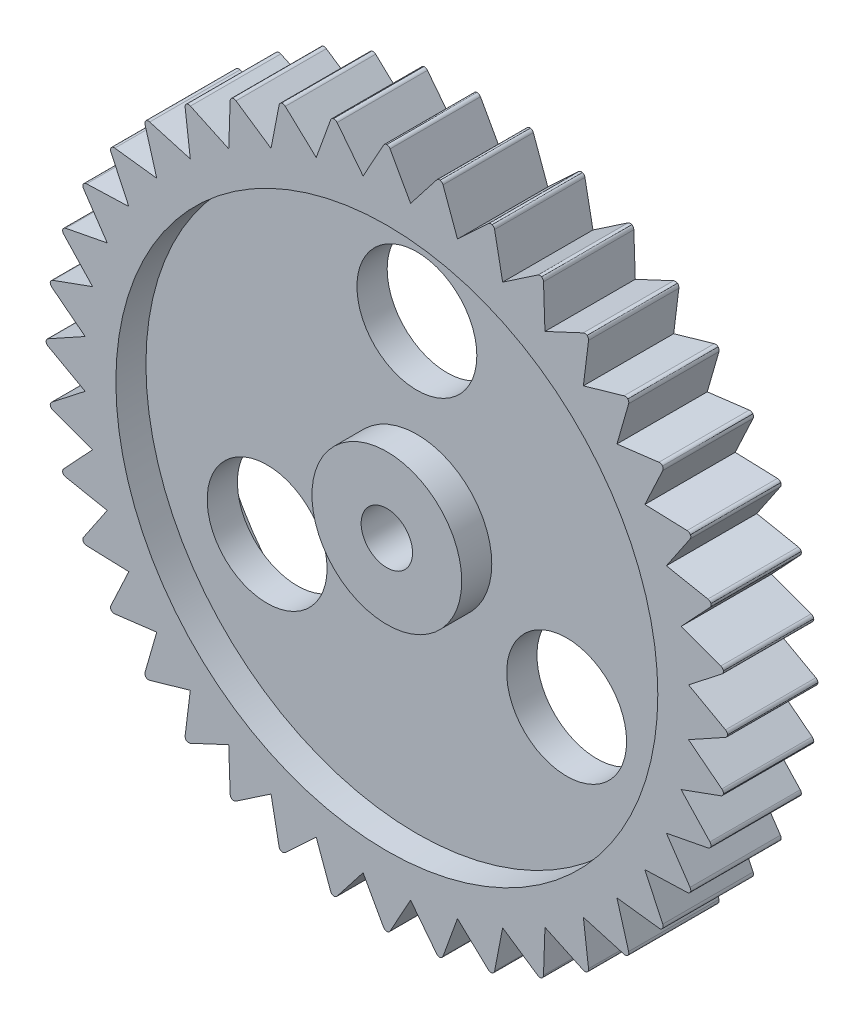
from build123d import *

# Parameters (mm, degrees)
SKETCH1_R         = 20.75
EXTRUDE1_DEPTH    = 2.75
SKETCH3_R         = 16.5
SKETCH3_R_2       = 4.56
EXTRUDE4_DEPTH    = 1.83
EXTRUDE5_REACH    = 31.856
SKETCH4_R         = 1.565
EXTRUDE6_REACH    = 31.574
SKETCH5_R         = 3.65
CIRPATTERN1_COUNT = 3
EXTRUDE17_REACH   = 31.856
CIRPATTERN2_COUNT = 40
FILLET2_R         = 0.25
CIRPATTERN3_START = -2.75
CIRPATTERN3_DEPTH = 5.5


# Read off the part's stored shape, not the designer's step: CirPattern3
with BuildPart() as part:
    # Sketch1 → Extrude1 (new, symmetric)
    with BuildSketch(Plane.XY):
        Circle(SKETCH1_R)
    extrude(amount=EXTRUDE1_DEPTH, both=True)

    # Sketch3 → Extrude4 (cut)
    with BuildSketch(Plane.XY.offset(2.75)):
        Circle(SKETCH3_R)
        Circle(SKETCH3_R_2, mode=Mode.SUBTRACT)
    extrude4 = extrude(amount=-EXTRUDE4_DEPTH, mode=Mode.SUBTRACT)

    # Mirror2: Extrude4 across plane
    add(extrude4.mirror(Plane.XY), mode=Mode.SUBTRACT)

    # Sketch4 → Extrude5 (cut, up to next)
    with BuildSketch(Plane.XY.offset(2.75), mode=Mode.PRIVATE) as extrude5_sk1:
        Circle(SKETCH4_R)
    extrude5_tool1 = extrude(extrude5_sk1.sketch, amount=-EXTRUDE5_REACH, mode=Mode.PRIVATE) & part.part
    add(extrude5_tool1.solids().sort_by_distance((0, 0, 2.75))[0], mode=Mode.SUBTRACT)

    # Sketch5 → Extrude6 (cut, up to next)
    with BuildSketch(Plane.XY.offset(0.92), mode=Mode.PRIVATE) as extrude6_sk1:
        with Locations((0, 10.53)):
            Circle(SKETCH5_R)
    extrude6_tool1 = extrude(extrude6_sk1.sketch, amount=-EXTRUDE6_REACH, mode=Mode.PRIVATE) & part.part
    extrude6 = extrude6_tool1.solids().sort_by_distance((0, 10.53, 0.92))[0]
    add(extrude6, mode=Mode.SUBTRACT)

    # CirPattern1: Extrude6 ×3 about axis
    cirpattern1_axis = Axis((0, 0, 0), (0, 0, 1))
    for i in range(1, CIRPATTERN1_COUNT):
        add(extrude6.rotate(cirpattern1_axis, i * 360 / CIRPATTERN1_COUNT), mode=Mode.SUBTRACT)

    # Sketch14 → Extrude17 (cut, up to next)
    with BuildSketch(Plane.XY.offset(2.75), mode=Mode.PRIVATE) as extrude17_sk1:
        with BuildLine():
            Line((-0.128390857, 20.749602786), (-1.445608839, 18.368201874))
            Line((-1.445608839, 18.368201874), (-3.119142859, 20.514225499))
            add(Edge.make_bspline(
                [(-3.119142859, 20.514225499), (-1.188149235, 20.932935947), (-0.128390857, 20.749602786)],
                knots=[0, 0, 0, 1, 1, 1], degree=2))
        make_face()
    extrude17_tool1 = extrude(extrude17_sk1.sketch, amount=-EXTRUDE17_REACH, mode=Mode.PRIVATE) & part.part
    extrude17 = extrude17_tool1.solids().sort_by_distance((-1.562372, 19.936347, 2.75))[0]
    add(extrude17, mode=Mode.SUBTRACT)

    # CirPattern2: Extrude17 ×40 about axis
    cirpattern2_axis = Axis((0, 0, 0), (0, 0, 1))
    for i in range(1, CIRPATTERN2_COUNT):
        add(extrude17.rotate(cirpattern2_axis, i * 360 / CIRPATTERN2_COUNT), mode=Mode.SUBTRACT)

    # Fillet2
    # the kernel refuses this fillet: 0.25 mm, written as the material it takes off along each edge
    with BuildSketch(Plane(origin=(-6.289872926, 19.773719897, 3.1196585), x_dir=(-0.9518642763784473, -0.3065198188609262, 0), z_dir=(0, 0, -1))) as fillet2_piece_1:
        with BuildLine():
            CenterArc((0.146972657, -0.249998413), FILLET2_R, 89.795856224, 61.105585606)
            Line((-0.071473459, -0.128420065), (0, 0))
            ThreePointArc((0, 0), (0.0739317, 0.000131709), (0.1478634, 0))
        make_face()
    extrude(amount=6.239317001, mode=Mode.SUBTRACT)
    with BuildSketch(Plane(origin=(-6.534086849, 19.694369984, 3.1196585), x_dir=(-0.18992112884271475, -0.9817993505900832, 0), z_dir=(0, 0, -1))) as fillet2_piece_2:
        with BuildLine():
            CenterArc((0.146969957, -0.25), FILLET2_R, 90, 61.105585606)
            ThreePointArc((-0.071907952, -0.129200741), (-0.036069061, -0.064536319), (0, 0))
            Line((0, 0), (0.146969957, 0))
        make_face()
    extrude(amount=6.239317001, mode=Mode.SUBTRACT)

    # CirPattern3 outline → CirPattern3 (cut)
    with BuildSketch(Plane.XY.offset(CIRPATTERN3_START)):
        with BuildLine():
            Line((-3.372763165, 20.474055989), (-3.422904926, 20.335903999))
            ThreePointArc((-3.422904926, 20.335903999), (-3.3543181, 20.437176535), (-3.24589778, 20.493792022))
            ThreePointArc((-3.24589778, 20.493792022), (-3.12528878, 20.473451216), (-3.028763898, 20.398329806))
            Line((-3.028763898, 20.398329806), (-3.119142859, 20.514225499))
            ThreePointArc((-3.119142859, 20.514225499), (-3.24601515, 20.494533067), (-3.372763165, 20.474055989))
        make_face()
        with BuildLine():
            Line((-9.53451963, 18.429743227), (-9.539515966, 18.282858221))
            ThreePointArc((-9.539515966, 18.282858221), (-9.505580953, 18.400368621), (-9.419962248, 18.48771687))
            ThreePointArc((-9.419962248, 18.48771687), (-9.298970619, 18.505641844), (-9.183956208, 18.464024967))
            Line((-9.183956208, 18.464024967), (-9.305725447, 18.546319686))
            ThreePointArc((-9.305725447, 18.546319686), (-9.42030287, 18.488385377), (-9.53451963, 18.429743227))
        make_face()
        with BuildLine():
            Line((-12.300180894, 16.711315028), (-12.28213784, 16.565456821))
            ThreePointArc((-12.28213784, 16.565456821), (-12.267003299, 16.686829078), (-12.19610298, 16.786495642))
            ThreePointArc((-12.19610298, 16.786495642), (-12.079405042, 16.823127191), (-11.959296335, 16.800014904))
            Line((-11.959296335, 16.800014904), (-12.092440123, 16.862247533))
            ThreePointArc((-12.092440123, 16.862247533), (-12.196543985, 16.787102633), (-12.300180894, 16.711315028))
        make_face()
        with BuildLine():
            Line((-14.762970883, 14.581398791), (-14.722332718, 14.440158896))
            ThreePointArc((-14.722332718, 14.440158896), (-14.726371313, 14.562404423), (-14.67193518, 14.67193518))
            ThreePointArc((-14.67193518, 14.67193518), (-14.562404423, 14.726371313), (-14.440158896, 14.722332718))
            Line((-14.440158896, 14.722332718), (-14.581398791, 14.762970883))
            ThreePointArc((-14.581398791, 14.762970883), (-14.67246571, 14.67246571), (-14.762970883, 14.581398791))
        make_face()
        with BuildLine():
            Line((-16.862247533, 12.092440123), (-16.800014904, 11.959296335))
            ThreePointArc((-16.800014904, 11.959296335), (-16.823127191, 12.079405042), (-16.786495642, 12.19610298))
            ThreePointArc((-16.786495642, 12.19610298), (-16.686829078, 12.267003299), (-16.565456821, 12.28213784))
            Line((-16.565456821, 12.28213784), (-16.711315028, 12.300180894))
            ThreePointArc((-16.711315028, 12.300180894), (-16.787102633, 12.196543985), (-16.862247533, 12.092440123))
        make_face()
        with BuildLine():
            Line((-18.546319686, 9.305725447), (-18.464024967, 9.183956208))
            ThreePointArc((-18.464024967, 9.183956208), (-18.505641844, 9.298970619), (-18.48771687, 9.419962248))
            ThreePointArc((-18.48771687, 9.419962248), (-18.400368621, 9.505580953), (-18.282858221, 9.539515966))
            Line((-18.282858221, 9.539515966), (-18.429743227, 9.53451963))
            ThreePointArc((-18.429743227, 9.53451963), (-18.488385377, 9.42030287), (-18.546319686, 9.305725447))
        make_face()
        with BuildLine():
            Line((-19.773719897, 6.289872926), (-19.673389457, 6.182476599))
            ThreePointArc((-19.673389457, 6.182476599), (-19.732486179, 6.289564677), (-19.733709152, 6.411870783))
            ThreePointArc((-19.733709152, 6.411870783), (-19.660830021, 6.510099656), (-19.550074975, 6.561999549))
            Line((-19.550074975, 6.561999549), (-19.694369984, 6.534086849))
            ThreePointArc((-19.694369984, 6.534086849), (-19.734422713, 6.412102633), (-19.773719897, 6.289872926))
        make_face()
        with BuildLine():
            Line((-20.514225499, 3.119142859), (-20.398329806, 3.028763898))
            ThreePointArc((-20.398329806, 3.028763898), (-20.473451216, 3.12528878), (-20.493792022, 3.24589778))
            ThreePointArc((-20.493792022, 3.24589778), (-20.437176535, 3.3543181), (-20.335903999, 3.422904926))
            Line((-20.335903999, 3.422904926), (-20.474055989, 3.372763165))
            ThreePointArc((-20.474055989, 3.372763165), (-20.494533067, 3.24601515), (-20.514225499, 3.119142859))
        make_face()
        with BuildLine():
            Line((-20.749602786, -0.128390857), (-20.620995577, -0.199527023))
            ThreePointArc((-20.620995577, -0.199527023), (-20.710291936, -0.1159421), (-20.749249717, 0))
            ThreePointArc((-20.749249717, 0), (-20.710291936, 0.1159421), (-20.620995577, 0.199527023))
            Line((-20.620995577, 0.199527023), (-20.749602786, 0.128390857))
            ThreePointArc((-20.749602786, 0.128390857), (-20.75, 0), (-20.749602786, -0.128390857))
        make_face()
        with BuildLine():
            Line((-20.474055989, -3.372763165), (-20.335903999, -3.422904926))
            ThreePointArc((-20.335903999, -3.422904926), (-20.437176535, -3.3543181), (-20.493792022, -3.24589778))
            ThreePointArc((-20.493792022, -3.24589778), (-20.473451216, -3.12528878), (-20.398329806, -3.028763898))
            Line((-20.398329806, -3.028763898), (-20.514225499, -3.119142859))
            ThreePointArc((-20.514225499, -3.119142859), (-20.494533067, -3.24601515), (-20.474055989, -3.372763165))
        make_face()
        with BuildLine():
            Line((-19.694369984, -6.534086849), (-19.550074975, -6.561999549))
            ThreePointArc((-19.550074975, -6.561999549), (-19.660830021, -6.510099656), (-19.733709152, -6.411870783))
            ThreePointArc((-19.733709152, -6.411870783), (-19.732486179, -6.289564677), (-19.673389457, -6.182476599))
            Line((-19.673389457, -6.182476599), (-19.773719897, -6.289872926))
            ThreePointArc((-19.773719897, -6.289872926), (-19.734422713, -6.412102633), (-19.694369984, -6.534086849))
        make_face()
        with BuildLine():
            Line((-18.429743227, -9.53451963), (-18.282858221, -9.539515966))
            ThreePointArc((-18.282858221, -9.539515966), (-18.400368621, -9.505580953), (-18.48771687, -9.419962248))
            ThreePointArc((-18.48771687, -9.419962248), (-18.505641844, -9.298970619), (-18.464024967, -9.183956208))
            Line((-18.464024967, -9.183956208), (-18.546319686, -9.305725447))
            ThreePointArc((-18.546319686, -9.305725447), (-18.488385377, -9.42030287), (-18.429743227, -9.53451963))
        make_face()
        with BuildLine():
            Line((-16.711315028, -12.300180894), (-16.565456821, -12.28213784))
            ThreePointArc((-16.565456821, -12.28213784), (-16.686829078, -12.267003299), (-16.786495642, -12.19610298))
            ThreePointArc((-16.786495642, -12.19610298), (-16.823127191, -12.079405042), (-16.800014904, -11.959296335))
            Line((-16.800014904, -11.959296335), (-16.862247533, -12.092440123))
            ThreePointArc((-16.862247533, -12.092440123), (-16.787102633, -12.196543985), (-16.711315028, -12.300180894))
        make_face()
        with BuildLine():
            Line((-14.581398791, -14.762970883), (-14.440158896, -14.722332718))
            ThreePointArc((-14.440158896, -14.722332718), (-14.562404423, -14.726371313), (-14.67193518, -14.67193518))
            ThreePointArc((-14.67193518, -14.67193518), (-14.726371313, -14.562404423), (-14.722332718, -14.440158896))
            Line((-14.722332718, -14.440158896), (-14.762970883, -14.581398791))
            ThreePointArc((-14.762970883, -14.581398791), (-14.67246571, -14.67246571), (-14.581398791, -14.762970883))
        make_face()
        with BuildLine():
            Line((-12.092440123, -16.862247533), (-11.959296335, -16.800014904))
            ThreePointArc((-11.959296335, -16.800014904), (-12.079405042, -16.823127191), (-12.19610298, -16.786495642))
            ThreePointArc((-12.19610298, -16.786495642), (-12.267003299, -16.686829078), (-12.28213784, -16.565456821))
            Line((-12.28213784, -16.565456821), (-12.300180894, -16.711315028))
            ThreePointArc((-12.300180894, -16.711315028), (-12.196543985, -16.787102633), (-12.092440123, -16.862247533))
        make_face()
        with BuildLine():
            Line((-9.305725447, -18.546319686), (-9.183956208, -18.464024967))
            ThreePointArc((-9.183956208, -18.464024967), (-9.298970619, -18.505641844), (-9.419962248, -18.48771687))
            ThreePointArc((-9.419962248, -18.48771687), (-9.505580953, -18.400368621), (-9.539515966, -18.282858221))
            Line((-9.539515966, -18.282858221), (-9.53451963, -18.429743227))
            ThreePointArc((-9.53451963, -18.429743227), (-9.42030287, -18.488385377), (-9.305725447, -18.546319686))
        make_face()
        with BuildLine():
            Line((-6.289872926, -19.773719897), (-6.182476599, -19.673389457))
            ThreePointArc((-6.182476599, -19.673389457), (-6.289564677, -19.732486179), (-6.411870783, -19.733709152))
            ThreePointArc((-6.411870783, -19.733709152), (-6.510099656, -19.660830021), (-6.561999549, -19.550074975))
            Line((-6.561999549, -19.550074975), (-6.534086849, -19.694369984))
            ThreePointArc((-6.534086849, -19.694369984), (-6.412102633, -19.734422713), (-6.289872926, -19.773719897))
        make_face()
        with BuildLine():
            Line((-3.119142859, -20.514225499), (-3.028763898, -20.398329806))
            ThreePointArc((-3.028763898, -20.398329806), (-3.12528878, -20.473451216), (-3.24589778, -20.493792022))
            ThreePointArc((-3.24589778, -20.493792022), (-3.3543181, -20.437176535), (-3.422904926, -20.335903999))
            Line((-3.422904926, -20.335903999), (-3.372763165, -20.474055989))
            ThreePointArc((-3.372763165, -20.474055989), (-3.24601515, -20.494533067), (-3.119142859, -20.514225499))
        make_face()
        with BuildLine():
            Line((0.128390857, -20.749602786), (0.199527023, -20.620995577))
            ThreePointArc((0.199527023, -20.620995577), (0.1159421, -20.710291936), (0, -20.749249717))
            ThreePointArc((0, -20.749249717), (-0.1159421, -20.710291936), (-0.199527023, -20.620995577))
            Line((-0.199527023, -20.620995577), (-0.128390857, -20.749602786))
            ThreePointArc((-0.128390857, -20.749602786), (0, -20.75), (0.128390857, -20.749602786))
        make_face()
        with BuildLine():
            Line((3.372763165, -20.474055989), (3.422904926, -20.335903999))
            ThreePointArc((3.422904926, -20.335903999), (3.3543181, -20.437176535), (3.24589778, -20.493792022))
            ThreePointArc((3.24589778, -20.493792022), (3.12528878, -20.473451216), (3.028763898, -20.398329806))
            Line((3.028763898, -20.398329806), (3.119142859, -20.514225499))
            ThreePointArc((3.119142859, -20.514225499), (3.24601515, -20.494533067), (3.372763165, -20.474055989))
        make_face()
        with BuildLine():
            Line((6.534086849, -19.694369984), (6.561999549, -19.550074975))
            ThreePointArc((6.561999549, -19.550074975), (6.510099656, -19.660830021), (6.411870783, -19.733709152))
            ThreePointArc((6.411870783, -19.733709152), (6.289564677, -19.732486179), (6.182476599, -19.673389457))
            Line((6.182476599, -19.673389457), (6.289872926, -19.773719897))
            ThreePointArc((6.289872926, -19.773719897), (6.412102633, -19.734422713), (6.534086849, -19.694369984))
        make_face()
        with BuildLine():
            Line((9.53451963, -18.429743227), (9.539515966, -18.282858221))
            ThreePointArc((9.539515966, -18.282858221), (9.505580953, -18.400368621), (9.419962248, -18.48771687))
            ThreePointArc((9.419962248, -18.48771687), (9.298970619, -18.505641844), (9.183956208, -18.464024967))
            Line((9.183956208, -18.464024967), (9.305725447, -18.546319686))
            ThreePointArc((9.305725447, -18.546319686), (9.42030287, -18.488385377), (9.53451963, -18.429743227))
        make_face()
        with BuildLine():
            Line((12.300180894, -16.711315028), (12.28213784, -16.565456821))
            ThreePointArc((12.28213784, -16.565456821), (12.267003299, -16.686829078), (12.19610298, -16.786495642))
            ThreePointArc((12.19610298, -16.786495642), (12.079405042, -16.823127191), (11.959296335, -16.800014904))
            Line((11.959296335, -16.800014904), (12.092440123, -16.862247533))
            ThreePointArc((12.092440123, -16.862247533), (12.196543985, -16.787102633), (12.300180894, -16.711315028))
        make_face()
        with BuildLine():
            Line((14.762970883, -14.581398791), (14.722332718, -14.440158896))
            ThreePointArc((14.722332718, -14.440158896), (14.726371313, -14.562404423), (14.67193518, -14.67193518))
            ThreePointArc((14.67193518, -14.67193518), (14.562404423, -14.726371313), (14.440158896, -14.722332718))
            Line((14.440158896, -14.722332718), (14.581398791, -14.762970883))
            ThreePointArc((14.581398791, -14.762970883), (14.67246571, -14.67246571), (14.762970883, -14.581398791))
        make_face()
        with BuildLine():
            Line((16.862247533, -12.092440123), (16.800014904, -11.959296335))
            ThreePointArc((16.800014904, -11.959296335), (16.823127191, -12.079405042), (16.786495642, -12.19610298))
            ThreePointArc((16.786495642, -12.19610298), (16.686829078, -12.267003299), (16.565456821, -12.28213784))
            Line((16.565456821, -12.28213784), (16.711315028, -12.300180894))
            ThreePointArc((16.711315028, -12.300180894), (16.787102633, -12.196543985), (16.862247533, -12.092440123))
        make_face()
        with BuildLine():
            Line((18.546319686, -9.305725447), (18.464024967, -9.183956208))
            ThreePointArc((18.464024967, -9.183956208), (18.505641844, -9.298970619), (18.48771687, -9.419962248))
            ThreePointArc((18.48771687, -9.419962248), (18.400368621, -9.505580953), (18.282858221, -9.539515966))
            Line((18.282858221, -9.539515966), (18.429743227, -9.53451963))
            ThreePointArc((18.429743227, -9.53451963), (18.488385377, -9.42030287), (18.546319686, -9.305725447))
        make_face()
        with BuildLine():
            Line((19.773719897, -6.289872926), (19.673389457, -6.182476599))
            ThreePointArc((19.673389457, -6.182476599), (19.732486179, -6.289564677), (19.733709152, -6.411870783))
            ThreePointArc((19.733709152, -6.411870783), (19.660830021, -6.510099656), (19.550074975, -6.561999549))
            Line((19.550074975, -6.561999549), (19.694369984, -6.534086849))
            ThreePointArc((19.694369984, -6.534086849), (19.734422713, -6.412102633), (19.773719897, -6.289872926))
        make_face()
        with BuildLine():
            Line((20.514225499, -3.119142859), (20.398329806, -3.028763898))
            ThreePointArc((20.398329806, -3.028763898), (20.473451216, -3.12528878), (20.493792022, -3.24589778))
            ThreePointArc((20.493792022, -3.24589778), (20.437176535, -3.3543181), (20.335903999, -3.422904926))
            Line((20.335903999, -3.422904926), (20.474055989, -3.372763165))
            ThreePointArc((20.474055989, -3.372763165), (20.494533067, -3.24601515), (20.514225499, -3.119142859))
        make_face()
        with BuildLine():
            Line((20.749602786, 0.128390857), (20.620995577, 0.199527023))
            ThreePointArc((20.620995577, 0.199527023), (20.710291936, 0.1159421), (20.749249717, 0))
            ThreePointArc((20.749249717, 0), (20.710291936, -0.1159421), (20.620995577, -0.199527023))
            Line((20.620995577, -0.199527023), (20.749602786, -0.128390857))
            ThreePointArc((20.749602786, -0.128390857), (20.75, 0), (20.749602786, 0.128390857))
        make_face()
        with BuildLine():
            Line((20.474055989, 3.372763165), (20.335903999, 3.422904926))
            ThreePointArc((20.335903999, 3.422904926), (20.437176535, 3.3543181), (20.493792022, 3.24589778))
            ThreePointArc((20.493792022, 3.24589778), (20.473451216, 3.12528878), (20.398329806, 3.028763898))
            Line((20.398329806, 3.028763898), (20.514225499, 3.119142859))
            ThreePointArc((20.514225499, 3.119142859), (20.494533067, 3.24601515), (20.474055989, 3.372763165))
        make_face()
        with BuildLine():
            Line((19.694369984, 6.534086849), (19.550074975, 6.561999549))
            ThreePointArc((19.550074975, 6.561999549), (19.660830021, 6.510099656), (19.733709152, 6.411870783))
            ThreePointArc((19.733709152, 6.411870783), (19.732486179, 6.289564677), (19.673389457, 6.182476599))
            Line((19.673389457, 6.182476599), (19.773719897, 6.289872926))
            ThreePointArc((19.773719897, 6.289872926), (19.734422713, 6.412102633), (19.694369984, 6.534086849))
        make_face()
        with BuildLine():
            Line((18.429743227, 9.53451963), (18.282858221, 9.539515966))
            ThreePointArc((18.282858221, 9.539515966), (18.400368621, 9.505580953), (18.48771687, 9.419962248))
            ThreePointArc((18.48771687, 9.419962248), (18.505641844, 9.298970619), (18.464024967, 9.183956208))
            Line((18.464024967, 9.183956208), (18.546319686, 9.305725447))
            ThreePointArc((18.546319686, 9.305725447), (18.488385377, 9.42030287), (18.429743227, 9.53451963))
        make_face()
        with BuildLine():
            Line((16.711315028, 12.300180894), (16.565456821, 12.28213784))
            ThreePointArc((16.565456821, 12.28213784), (16.686829078, 12.267003299), (16.786495642, 12.19610298))
            ThreePointArc((16.786495642, 12.19610298), (16.823127191, 12.079405042), (16.800014904, 11.959296335))
            Line((16.800014904, 11.959296335), (16.862247533, 12.092440123))
            ThreePointArc((16.862247533, 12.092440123), (16.787102633, 12.196543985), (16.711315028, 12.300180894))
        make_face()
        with BuildLine():
            Line((14.581398791, 14.762970883), (14.440158896, 14.722332718))
            ThreePointArc((14.440158896, 14.722332718), (14.562404423, 14.726371313), (14.67193518, 14.67193518))
            ThreePointArc((14.67193518, 14.67193518), (14.726371313, 14.562404423), (14.722332718, 14.440158896))
            Line((14.722332718, 14.440158896), (14.762970883, 14.581398791))
            ThreePointArc((14.762970883, 14.581398791), (14.67246571, 14.67246571), (14.581398791, 14.762970883))
        make_face()
        with BuildLine():
            Line((12.092440123, 16.862247533), (11.959296335, 16.800014904))
            ThreePointArc((11.959296335, 16.800014904), (12.079405042, 16.823127191), (12.19610298, 16.786495642))
            ThreePointArc((12.19610298, 16.786495642), (12.267003299, 16.686829078), (12.28213784, 16.565456821))
            Line((12.28213784, 16.565456821), (12.300180894, 16.711315028))
            ThreePointArc((12.300180894, 16.711315028), (12.196543985, 16.787102633), (12.092440123, 16.862247533))
        make_face()
        with BuildLine():
            Line((9.305725447, 18.546319686), (9.183956208, 18.464024967))
            ThreePointArc((9.183956208, 18.464024967), (9.298970619, 18.505641844), (9.419962248, 18.48771687))
            ThreePointArc((9.419962248, 18.48771687), (9.505580953, 18.400368621), (9.539515966, 18.282858221))
            Line((9.539515966, 18.282858221), (9.53451963, 18.429743227))
            ThreePointArc((9.53451963, 18.429743227), (9.42030287, 18.488385377), (9.305725447, 18.546319686))
        make_face()
        with BuildLine():
            Line((6.289872926, 19.773719897), (6.182476599, 19.673389457))
            ThreePointArc((6.182476599, 19.673389457), (6.289564677, 19.732486179), (6.411870783, 19.733709152))
            ThreePointArc((6.411870783, 19.733709152), (6.510099656, 19.660830021), (6.561999549, 19.550074975))
            Line((6.561999549, 19.550074975), (6.534086849, 19.694369984))
            ThreePointArc((6.534086849, 19.694369984), (6.412102633, 19.734422713), (6.289872926, 19.773719897))
        make_face()
        with BuildLine():
            Line((3.119142859, 20.514225499), (3.028763898, 20.398329806))
            ThreePointArc((3.028763898, 20.398329806), (3.12528878, 20.473451216), (3.24589778, 20.493792022))
            ThreePointArc((3.24589778, 20.493792022), (3.3543181, 20.437176535), (3.422904926, 20.335903999))
            Line((3.422904926, 20.335903999), (3.372763165, 20.474055989))
            ThreePointArc((3.372763165, 20.474055989), (3.24601515, 20.494533067), (3.119142859, 20.514225499))
        make_face()
        with BuildLine():
            Line((-0.128390857, 20.749602786), (-0.199527023, 20.620995577))
            ThreePointArc((-0.199527023, 20.620995577), (-0.1159421, 20.710291936), (0, 20.749249717))
            ThreePointArc((0, 20.749249717), (0.1159421, 20.710291936), (0.199527023, 20.620995577))
            Line((0.199527023, 20.620995577), (0.128390857, 20.749602786))
            ThreePointArc((0.128390857, 20.749602786), (0, 20.75), (-0.128390857, 20.749602786))
        make_face()
    extrude(amount=CIRPATTERN3_DEPTH, mode=Mode.SUBTRACT)


solid = part.part
